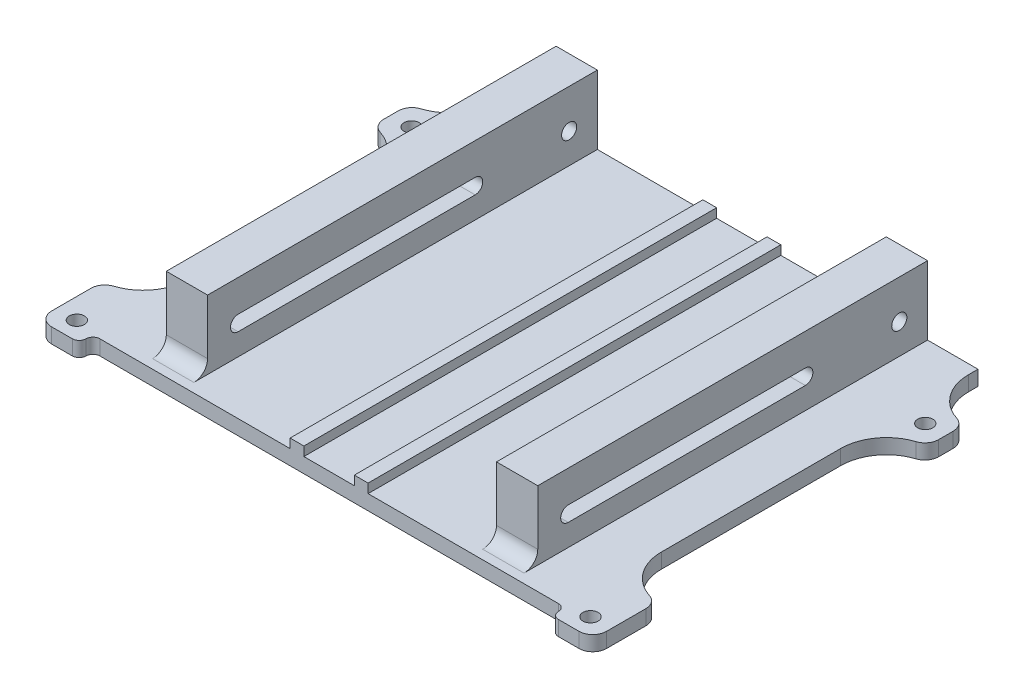
from build123d import *

# Parameters (mm, degrees)
SKETCH1_W            = 103
SKETCH1_H            = 65
BOSS_EXTRUDE1_DEPTH  = 3.25
SKETCH2_W            = 9
SKETCH2_H            = 65
BOSS_EXTRUDE2_DEPTH  = 15
CUT_EXTRUDE1_DEPTH   = 91.985232318
BOSS_EXTRUDE3_DEPTH  = 20
SKETCH5_R            = 1.65
CUT_EXTRUDE2_DEPTH   = 100.891503643
SKETCH11_W           = 103
SKETCH11_H           = 3.25
BOSS_EXTRUDE8_DEPTH  = 5
SKETCH12_W           = 9
SKETCH12_H           = 8
SKETCH12_R           = 1.65
BOSS_EXTRUDE9_DEPTH  = 3.25
SKETCH15_W           = 9
SKETCH15_H           = 3.25
BOSS_EXTRUDE10_DEPTH = 6
FILLET1_R            = 10
FILLET2_R            = 1.5
FILLET3_R            = 3
FILLET4_R            = 3
SKETCH16_W           = 3
SKETCH16_H           = 90
BOSS_EXTRUDE11_DEPTH = 2


# Some blends are built 0.0001 mm under size
with BuildPart() as part:
    # Sketch1 → Boss-Extrude1 (new body)
    with BuildSketch(Plane(origin=(0, 0, 0), x_dir=(1, 0, 0), z_dir=(0, 1, 0))):
        Rectangle(SKETCH1_W, SKETCH1_H)
    extrude(amount=BOSS_EXTRUDE1_DEPTH)

    # Sketch2 → Boss-Extrude2 (add)
    with BuildSketch(Plane(origin=(0, 3.25, 0), x_dir=(1, 0, 0), z_dir=(0, 1, 0))):
        with Locations((-36, 0)):
            Rectangle(SKETCH2_W, SKETCH2_H)
    boss_extrude2 = extrude(amount=BOSS_EXTRUDE2_DEPTH)

    # Sketch3 → Cut-Extrude1 (cut, through all)
    with BuildSketch(Plane(origin=(-31.5, 0, 0), x_dir=(0, 0, -1), z_dir=(1, 0, 0))):
        with BuildLine():
            Line((25.85, 8), (-25.85, 8))
            ThreePointArc((-25.85, 8), (-27.5, 9.65), (-25.85, 11.3))
            Line((-25.85, 11.3), (25.85, 11.3))
            ThreePointArc((25.85, 11.3), (27.5, 9.65), (25.85, 8))
        make_face()
    cut_extrude1 = extrude(amount=-CUT_EXTRUDE1_DEPTH, mode=Mode.SUBTRACT)

    # Sketch4 → Boss-Extrude3 (add)
    with BuildSketch(Plane(origin=(0, 0, -32.5), x_dir=(-1, 0, 0), z_dir=(0, 0, -1))):
        Polygon((51.5, 3.25), (40.5, 3.25), (40.5, 18.25), (31.5, 18.25), (31.5, 3.25), (-51.5, 3.25), (-51.5, 0), (51.5, 0), align=None)
    boss_extrude3 = extrude(amount=BOSS_EXTRUDE3_DEPTH)

    # Sketch5 → Cut-Extrude2 (cut, through all)
    with BuildSketch(Plane(origin=(-31.5, 0, 0), x_dir=(0, 0, -1), z_dir=(1, 0, 0))):
        with Locations((46.339135755, 9.8)):
            Circle(SKETCH5_R)
    cut_extrude2 = extrude(amount=-CUT_EXTRUDE2_DEPTH, mode=Mode.SUBTRACT)

    # Mirror1: Boss-Extrude2, Cut-Extrude1, Boss-Extrude3, Cut-Extrude2 across plane
    add(boss_extrude2.mirror(Plane(origin=(0, 0, 0), x_dir=(0, 0, 1), z_dir=(1, 0, 0))))
    add(cut_extrude1.mirror(Plane(origin=(0, 0, 0), x_dir=(0, 0, 1), z_dir=(1, 0, 0))), mode=Mode.SUBTRACT)
    add(boss_extrude3.mirror(Plane(origin=(0, 0, 0), x_dir=(0, 0, 1), z_dir=(1, 0, 0))))
    add(cut_extrude2.mirror(Plane(origin=(0, 0, 0), x_dir=(0, 0, 1), z_dir=(1, 0, 0))), mode=Mode.SUBTRACT)

    # Sketch11 → Boss-Extrude8 (add)
    with BuildSketch(Plane.XY.offset(32.5)):
        with Locations((0, 1.625)):
            Rectangle(SKETCH11_W, SKETCH11_H)
    extrude(amount=BOSS_EXTRUDE8_DEPTH)

    # Sketch12 → Boss-Extrude9 (add)
    # profile 1 of 4: a face of its own
    with BuildSketch(Plane(origin=(0, 0, 0), x_dir=(1, 0, 0), z_dir=(0, 1, 0))):
        with Locations((56, -36.5)):
            Rectangle(SKETCH12_W, SKETCH12_H)
        with Locations(Location((56, -36.5, 0), (0, 0, 90))):
            Circle(SKETCH12_R, mode=Mode.SUBTRACT)
    # profile 2 of 4: a face of its own
    with BuildSketch(Plane(origin=(0, 0, 0), x_dir=(1, 0, 0), z_dir=(0, 1, 0))):
        with Locations((56, 36.5)):
            Rectangle(SKETCH12_W, SKETCH12_H)
        with Locations(Location((56, 36.5, 0), (0, 0, 90))):
            Circle(SKETCH12_R, mode=Mode.SUBTRACT)
    # profile 3 of 4: a face of its own
    with BuildSketch(Plane(origin=(0, 0, 0), x_dir=(1, 0, 0), z_dir=(0, 1, 0))):
        with Locations((-56, 36.5)):
            Rectangle(SKETCH12_W, SKETCH12_H)
        with Locations(Location((-56, 36.5, 0), (0, 0, 90))):
            Circle(SKETCH12_R, mode=Mode.SUBTRACT)
    # profile 4 of 4: a face of its own
    with BuildSketch(Plane(origin=(0, 0, 0), x_dir=(1, 0, 0), z_dir=(0, 1, 0))):
        with Locations((-56, -36.5)):
            Rectangle(SKETCH12_W, SKETCH12_H)
        with Locations(Location((-56, -36.5, 0), (0, 0, 90))):
            Circle(SKETCH12_R, mode=Mode.SUBTRACT)
    extrude(amount=BOSS_EXTRUDE9_DEPTH)

    # Sketch15 → Boss-Extrude10 (add)
    with BuildSketch(Plane(origin=(0, 0, 32.5), x_dir=(-1, 0, 0), z_dir=(0, 0, -1))):
        with Locations((56, 1.625)):
            Rectangle(SKETCH15_W, SKETCH15_H)
        with Locations((-56, 1.625)):
            Rectangle(SKETCH15_W, SKETCH15_H)
    extrude(amount=BOSS_EXTRUDE10_DEPTH)

    # Fillet1
    # the kernel refuses this fillet: 10 mm, written as the material it adds along each edge
    with BuildSketch(Plane(origin=(51.5, 0, 26.5), x_dir=(1, 0, 0), z_dir=(0, 1, 0)), Plane(origin=(51.5, 0, -40.5), x_dir=(1, 0, 0), z_dir=(0, 1, 0)), Plane(origin=(-51.5, 0, -32.5), x_dir=(-1, 0, 0), z_dir=(0, 1, 0))) as fillet1_piece_1:
        with BuildLine():
            CenterArc((10, 9.949874371), FILLET1_R, 180, 84.260829523)
            Line((0, 9.949874371), (-0.2, 9.949874371))
            Line((-0.2, 9.949874371), (-0.2, 0))
            Line((-0.2, 0), (0, -0.2))
            ThreePointArc((0, -0.2), (4.5, -0.2), (8.98, -0.198997487))
            Line((8.98, -0.198997487), (9, 0))
        make_face()
    extrude(amount=3.25)
    with BuildSketch(Plane(origin=(51.5, 0, -32.5), x_dir=(0, 0, 1), z_dir=(0, 1, 0)), Plane(origin=(-51.5, 0, -40.5), x_dir=(0, 0, -1), z_dir=(0, 1, 0))) as fillet1_piece_2:
        with BuildLine():
            CenterArc((9.949874371, 10), FILLET1_R, 185.739170477, 84.260829523)
            Line((0, 9), (-0.198997487, 8.98))
            ThreePointArc((-0.198997487, 8.98), (-0.2, 4.5), (-0.2, 0))
            Line((-0.2, 0), (0, -0.2))
            Line((0, -0.2), (9.949874371, -0.2))
            Line((9.949874371, -0.2), (9.949874371, 0))
        make_face()
    extrude(amount=3.25)
    with BuildSketch(Plane(origin=(-51.5, 3.25, 26.5), x_dir=(0, 0, -1), z_dir=(0, -1, 0))) as fillet1_piece_3:
        with BuildLine():
            CenterArc((9.949874371, -10), FILLET1_R, 90, 84.260829523)
            Line((0, -9), (-0.198997487, -8.98))
            ThreePointArc((-0.198997487, -8.98), (-0.2, -4.5), (-0.2, 0))
            Line((-0.2, 0), (0, 0.2))
            Line((0, 0.2), (9.949874371, 0.2))
            Line((9.949874371, 0.2), (9.949874371, 0))
        make_face()
    extrude(amount=3.25)

    # Fillet2
    fillet2_edges = [part.edges().sort_by_distance(p)[0] for p in [
        (-51.5, 1.625, 37.5),
        (51.5, 1.625, 37.5),
    ]]
    fillet(fillet2_edges, radius=FILLET2_R)
    fillet2_2_edges = [part.edges().sort_by_distance(p)[0] for p in [
        (-51.5, 1.625, 40.5),
        (51.5, 1.625, 40.5),
    ]]
    fillet(fillet2_2_edges, radius=FILLET2_R - 0.0001)  # a hair under: the kernel refuses the full size

    # Fillet3
    fillet3_edges = [part.edges().sort_by_distance(p)[0] for p in [
        (-60.5, 1.625, 40.5),
        (-60.5, 1.625, -40.5),
        (-60.5, 1.625, -32.5),
        (60.5, 1.625, -40.5),
        (60.5, 1.625, -32.5),
        (60.5, 1.625, 40.5),
        (-60.5, 1.625, 26.5),
        (60.5, 1.625, 26.5),
    ]]
    fillet(fillet3_edges, radius=FILLET3_R)

    # Fillet4
    fillet4_edges = [part.edges().sort_by_distance(p)[0] for p in [
        (-36, 3.25, 32.5),
        (36, 3.25, 32.5),
    ]]
    fillet(fillet4_edges, radius=FILLET4_R)

    # Sketch16 → Boss-Extrude11 (add)
    with BuildSketch(Plane(origin=(0, 3.25, 0), x_dir=(1, 0, 0), z_dir=(0, 1, 0))):
        with Locations((-7, 7.5)):
            Rectangle(SKETCH16_W, SKETCH16_H)
    boss_extrude11 = extrude(amount=BOSS_EXTRUDE11_DEPTH)

    # Mirror2: Boss-Extrude11 across plane
    add(boss_extrude11.mirror(Plane(origin=(0, 0, 0), x_dir=(0, 0, 1), z_dir=(1, 0, 0))))


solid = part.part
